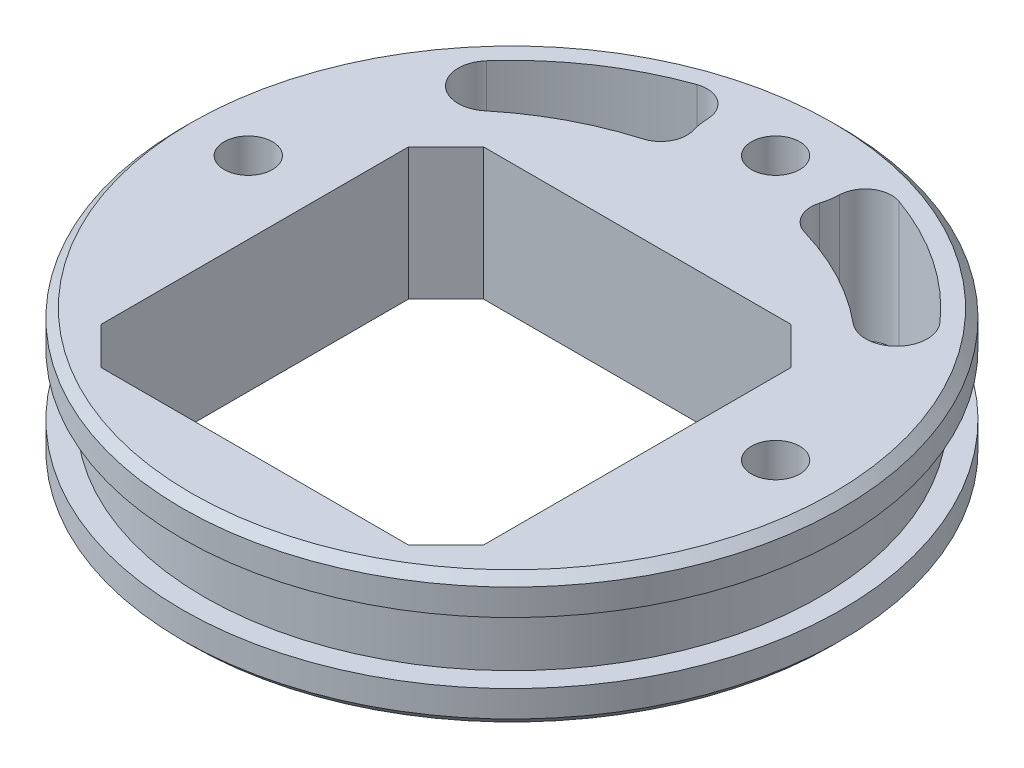
from build123d import *

# Parameters (mm, degrees)
SKETCH1_R               = 37.5
SKETCH1_R_2             = 2.75
BOSS_EXTRUDE1_DEPTH     = 7.5
SKETCH2_R               = 45
SKETCH2_R_2             = 35
CUT_EXTRUDE_THIN1_DEPTH = 3.5
CHAMFER1_SIZE           = 1


with BuildPart() as part:
    # Sketch1 → Boss-Extrude1 (new, symmetric)
    with BuildSketch(Plane(origin=(0, 0, 0), x_dir=(1, 0, 0), z_dir=(0, 1, 0))):
        Circle(SKETCH1_R)
        with Locations((0, 30)):
            Circle(SKETCH1_R_2, mode=Mode.SUBTRACT)
        with Locations((30, 0)):
            Circle(SKETCH1_R_2, mode=Mode.SUBTRACT)
        with Locations((-30, 0)):
            Circle(SKETCH1_R_2, mode=Mode.SUBTRACT)
        Polygon((-17.494426356, 14.25), (17.494426356, 14.25), (21.75, 9.994426356), (21.75, -24.994426356), (17.494426356, -29.25), (-17.494426356, -29.25), (-21.75, -24.994426356), (-21.75, 9.994426356), align=None, mode=Mode.SUBTRACT)
        with BuildLine():
            ThreePointArc((7.182286097, 27.840192967), (7.403794259, 28.802573354), (7.496938151, 29.785714286))
            ThreePointArc((7.496938151, 29.785714286), (8.798657136, 32.173863375), (11.495305164, 32.528571429))
            ThreePointArc((11.495305164, 32.528571429), (19.261751293, 28.622280432), (25.805142244, 22.898572746))
            ThreePointArc((25.805142244, 22.898572746), (25.70559409, 18.144924559), (20.958464106, 17.876898763))
            ThreePointArc((20.958464106, 17.876898763), (15.403995181, 21.585411137), (9.215229657, 24.09626166))
            ThreePointArc((9.215229657, 24.09626166), (7.418794885, 25.54470973), (7.182286097, 27.840192967))
        make_face(mode=Mode.SUBTRACT)
        with BuildLine():
            ThreePointArc((-25.805142244, 22.898572746), (-25.70559409, 18.144924559), (-20.958464106, 17.876898763))
            ThreePointArc((-20.958464106, 17.876898763), (-15.403995181, 21.585411137), (-9.215229657, 24.09626166))
            ThreePointArc((-9.215229657, 24.09626166), (-7.418794885, 25.54470973), (-7.182286097, 27.840192967))
            ThreePointArc((-7.182286097, 27.840192967), (-7.403794259, 28.802573354), (-7.496938151, 29.785714286))
            ThreePointArc((-7.496938151, 29.785714286), (-8.798657136, 32.173863375), (-11.495305164, 32.528571429))
            ThreePointArc((-11.495305164, 32.528571429), (-19.261751293, 28.622280432), (-25.805142244, 22.898572746))
        make_face(mode=Mode.SUBTRACT)
    extrude(amount=BOSS_EXTRUDE1_DEPTH, both=True)

    # Sketch2 → Cut-Extrude-Thin1 (cut, symmetric)
    with BuildSketch(Plane(origin=(0, 0, 0), x_dir=(1, 0, 0), z_dir=(0, 1, 0))):
        Circle(SKETCH2_R)
        Circle(SKETCH2_R_2, mode=Mode.SUBTRACT)
    extrude(amount=CUT_EXTRUDE_THIN1_DEPTH, both=True, mode=Mode.SUBTRACT)

    # Chamfer1
    chamfer1_edges = [part.edges().sort_by_distance(p)[0] for p in [
        (-37.5, -7.5, 0),
        (-37.5, 7.5, 0),
    ]]
    chamfer(chamfer1_edges, length=CHAMFER1_SIZE)


solid = part.part
